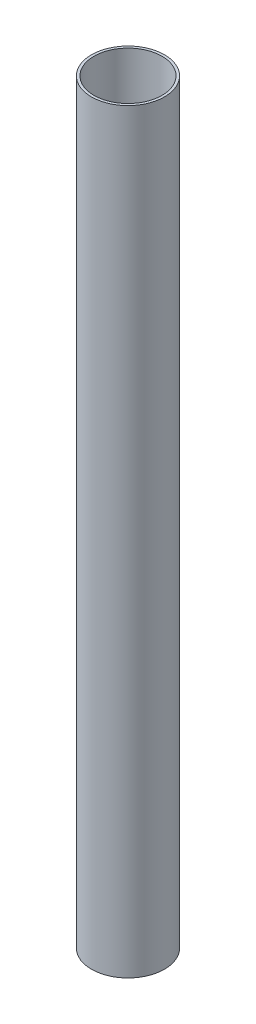
from build123d import *

# Parameters (mm, degrees)
SKETCH1_R           = 29
SKETCH1_R_2         = 27
BOSS_EXTRUDE1_DEPTH = 600


with BuildPart() as part:
    # Sketch1 → Boss-Extrude1 (new body)
    with BuildSketch(Plane(origin=(0, 0, 0), x_dir=(1, 0, 0), z_dir=(0, 1, 0))):
        Circle(SKETCH1_R)
        Circle(SKETCH1_R_2, mode=Mode.SUBTRACT)
    extrude(amount=BOSS_EXTRUDE1_DEPTH)


solid = part.part
